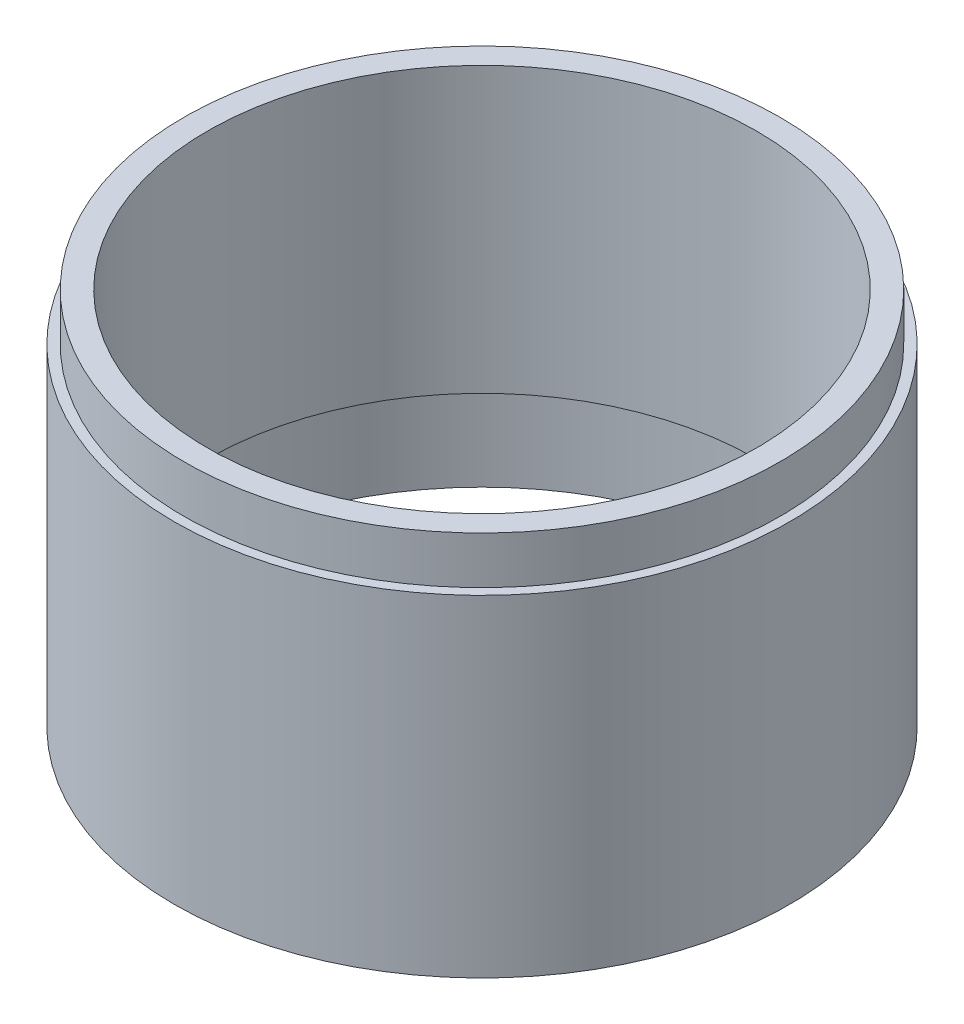
from build123d import *


with BuildPart() as part:
    # Szkic1 → Obrót1 (revolve)
    with BuildSketch(Plane.XY):
        Polygon((-65, 0), (-62, 0), (-62, 20), (-58, 20), (-58, 80), (-63, 80), (-63, 70), (-65, 70), (-65, 20), align=None)
    revolve(axis=Axis((0, 0, 0), (0, 1, 0)))


solid = part.part
